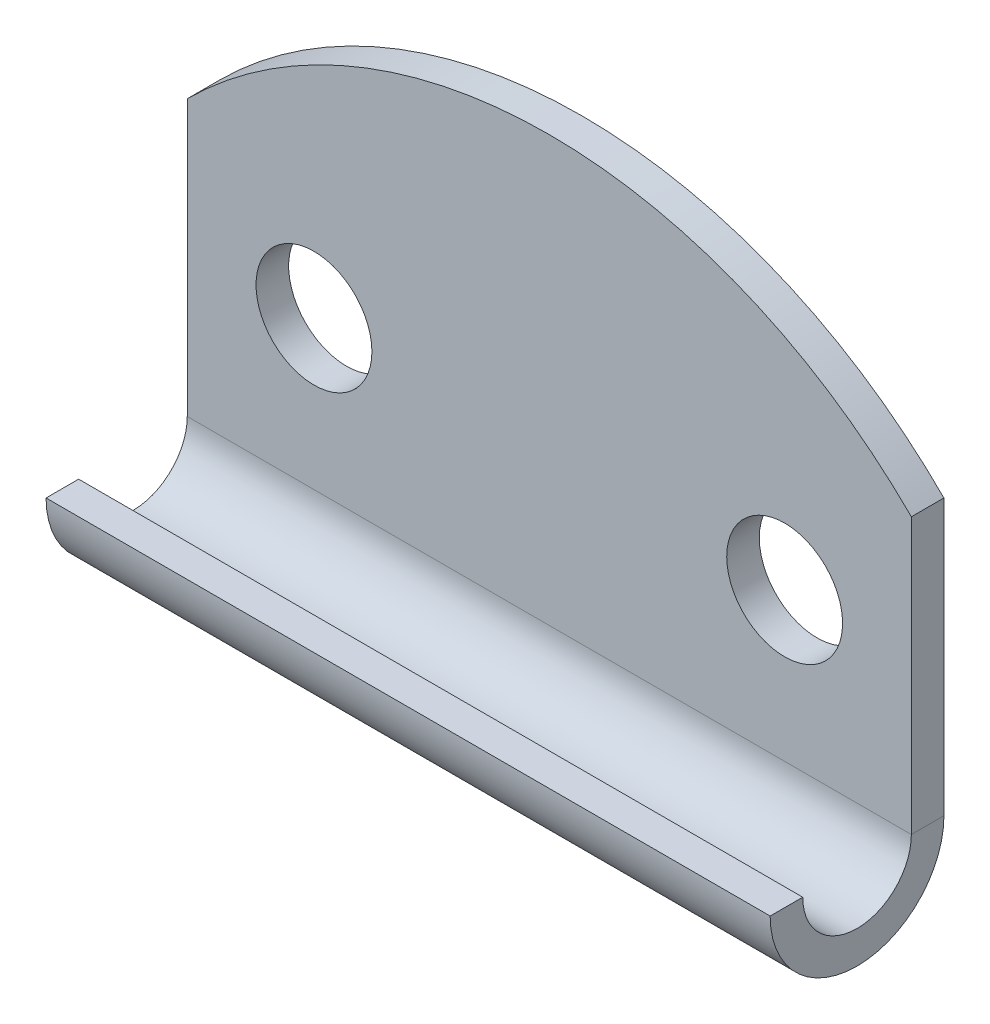
from build123d import *

# Parameters (mm, degrees)
SKETCH_1_R             = 1.6
SM_BASE_FLANGE_1_DEPTH = 0.9
OTHER_START            = -10
OTHER_1_DEPTH          = 20
OTHER_1_2_DEPTH        = 20


# Read off the part's stored shape, not the designer's step: 褶边1
# Sheet-metal steps are written as plain solids
with BuildPart() as part:
    # Sketch 1 → 基体-法兰1 (new body)
    with BuildSketch(Plane.XY):
        with BuildLine():
            Line((10, 0), (-10, 0))
            Line((-10, 0), (-10, 10))
            ThreePointArc((-10, 10), (0, 14.142135624), (10, 10))
            Line((10, 10), (10, 0))
        make_face()
        with Locations((-6.5, 6.5)):
            Circle(SKETCH_1_R, mode=Mode.SUBTRACT)
        with Locations(Location((6.5, 6.5, 0), (0, 0, 180))):
            Circle(SKETCH_1_R, mode=Mode.SUBTRACT)
    extrude(amount=-SM_BASE_FLANGE_1_DEPTH)

    # Other 1 outline → Other 1 (cut)
    with BuildSketch(Plane.YZ.offset(OTHER_START)):
        with BuildLine():
            ThreePointArc((2.4, -0.9), (1.360769515, -0.663330765), (0.5265006, 0))
            Line((0.5265006, 0), (0, 0))
            Line((0, 0), (0, -0.9))
            Line((0, -0.9), (2.4, -0.9))
        make_face()
    extrude(amount=OTHER_1_DEPTH, mode=Mode.SUBTRACT)

    # Other 1 2 outline → Other 1 2 (add)
    with BuildSketch(Plane.YZ.offset(OTHER_START)):
        with BuildLine():
            Line((2.4, 3), (2.4, 3.9))
            ThreePointArc((2.4, 3.9), (0.236669235, 2.539230485), (0.5265006, 0))
            Line((0.5265006, 0), (2.4, 0))
            ThreePointArc((2.4, 0), (0.9, 1.5), (2.4, 3))
        make_face()
    extrude(amount=OTHER_1_2_DEPTH)


solid = part.part
